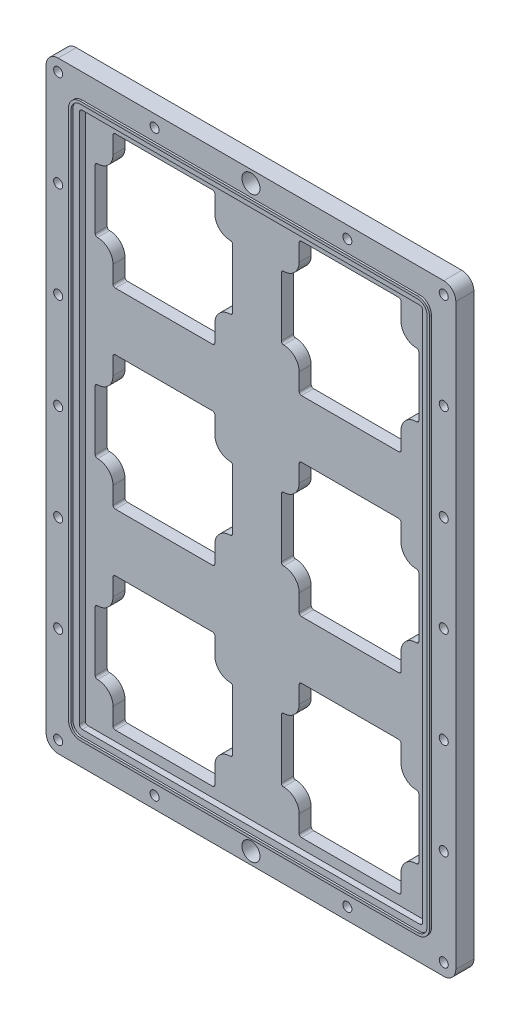
from build123d import *

# Parameters (mm, degrees)
SKETCH1_W            = 215.9
SKETCH1_H            = 317.5
BOSS_EXTRUDE1_DEPTH  = 9.525
SKETCH4_R            = 2.38125
CUT_EXTRUDE1_DEPTH   = 385.070026981
CUT_EXTRUDE3_DEPTH   = 3.175
BOSS_EXTRUDE2_DEPTH  = 1.016
SKETCH7_R            = 4.7625
CUT_EXTRUDE4_DEPTH   = 385.070026981
FILLET1_R            = 6.35
CUT_EXTRUDE5_DEPTH   = 3.175
CUT_EXTRUDE6_DEPTH   = 385.09656687
SKETCH11_R           = 1.3462
CUT_EXTRUDE7_DEPTH   = 4.7625
LPATTERN1_COUNT      = 2
LPATTERN1_PITCH      = 98.0948
LPATTERN1_COUNT_DIR2 = 3
LPATTERN1_PITCH_DIR2 = 100.8634


with BuildPart() as part:
    # Sketch1 → Boss-Extrude1 (new body)
    with BuildSketch(Plane.XY):
        with Locations((107.95, 158.75)):
            Rectangle(SKETCH1_W, SKETCH1_H)
    extrude(amount=BOSS_EXTRUDE1_DEPTH)

    # Sketch4 → Cut-Extrude1 (cut, through all)
    with BuildSketch(Plane.XY.offset(9.525)):
        with Locations((6.35, 6.35)):
            Circle(SKETCH4_R)
        with Locations((6.35, 311.15)):
            Circle(SKETCH4_R)
        with Locations((209.55, 311.15)):
            Circle(SKETCH4_R)
        with Locations((209.55, 6.35)):
            Circle(SKETCH4_R)
        with Locations((57.15, 311.15)):
            Circle(SKETCH4_R)
        with Locations((57.15, 6.35)):
            Circle(SKETCH4_R)
        with Locations((107.95, 311.15)):
            Circle(SKETCH4_R)
        with Locations((107.95, 6.35)):
            Circle(SKETCH4_R)
        with Locations((158.75, 311.15)):
            Circle(SKETCH4_R)
        with Locations((158.75, 6.35)):
            Circle(SKETCH4_R)
        with Locations((6.35, 260.35)):
            Circle(SKETCH4_R)
        with Locations((209.55, 260.35)):
            Circle(SKETCH4_R)
        with Locations((6.35, 209.55)):
            Circle(SKETCH4_R)
        with Locations((209.55, 209.55)):
            Circle(SKETCH4_R)
        with Locations((6.35, 158.75)):
            Circle(SKETCH4_R)
        with Locations((209.55, 158.75)):
            Circle(SKETCH4_R)
        with Locations((6.35, 107.95)):
            Circle(SKETCH4_R)
        with Locations((209.55, 107.95)):
            Circle(SKETCH4_R)
        with Locations((6.35, 57.15)):
            Circle(SKETCH4_R)
        with Locations((209.55, 57.15)):
            Circle(SKETCH4_R)
    extrude(amount=-CUT_EXTRUDE1_DEPTH, mode=Mode.SUBTRACT)

    # Sketch6 → Cut-Extrude3 (cut)
    with BuildSketch(Plane.XY.offset(9.525)):
        with BuildLine():
            Line((196.85, 300.0375), (19.05, 300.0375))
            ThreePointArc((19.05, 300.0375), (17.927467985, 299.572532015), (17.4625, 298.45))
            Line((17.4625, 298.45), (17.4625, 19.05))
            ThreePointArc((17.4625, 19.05), (17.927467985, 17.927467985), (19.05, 17.4625))
            Line((19.05, 17.4625), (196.85, 17.4625))
            ThreePointArc((196.85, 17.4625), (197.972532015, 17.927467985), (198.4375, 19.05))
            Line((198.4375, 19.05), (198.4375, 298.45))
            ThreePointArc((198.4375, 298.45), (197.972532015, 299.572532015), (196.85, 300.0375))
        make_face()
    extrude(amount=-CUT_EXTRUDE3_DEPTH, mode=Mode.SUBTRACT)

    # Sketch5 → Boss-Extrude2 (add)
    with BuildSketch(Plane.XY.offset(9.525)):
        with BuildLine():
            ThreePointArc((19.05, 304.673), (14.649674501, 302.850325499), (12.827, 298.45))
            Line((12.827, 298.45), (12.827, 19.05))
            ThreePointArc((12.827, 19.05), (14.649674501, 14.649674501), (19.05, 12.827))
            Line((19.05, 12.827), (196.85, 12.827))
            ThreePointArc((196.85, 12.827), (201.250325499, 14.649674501), (203.073, 19.05))
            Line((203.073, 19.05), (203.073, 298.45))
            ThreePointArc((203.073, 298.45), (201.250325499, 302.850325499), (196.85, 304.673))
            Line((196.85, 304.673), (19.05, 304.673))
        make_face()
        with BuildLine():
            ThreePointArc((196.85, 303.3395), (200.307398607, 301.907398607), (201.7395, 298.45))
            Line((201.7395, 298.45), (201.7395, 19.05))
            ThreePointArc((201.7395, 19.05), (200.307398607, 15.592601393), (196.85, 14.1605))
            Line((196.85, 14.1605), (19.05, 14.1605))
            ThreePointArc((19.05, 14.1605), (15.592601393, 15.592601393), (14.1605, 19.05))
            Line((14.1605, 19.05), (14.1605, 298.45))
            ThreePointArc((14.1605, 298.45), (15.592601393, 301.907398607), (19.05, 303.3395))
            Line((19.05, 303.3395), (196.85, 303.3395))
        make_face(mode=Mode.SUBTRACT)
    extrude(amount=BOSS_EXTRUDE2_DEPTH)

    # Sketch7 → Cut-Extrude4 (cut, through all)
    with BuildSketch(Plane.XY.offset(9.525)):
        with Locations((107.95, 6.35)):
            Circle(SKETCH7_R)
        with Locations((107.95, 311.15)):
            Circle(SKETCH7_R)
    extrude(amount=-CUT_EXTRUDE4_DEPTH, mode=Mode.SUBTRACT)

    # Fillet1
    fillet1_edges = [part.edges().sort_by_distance(p)[0] for p in [
        (0, 317.5, 4.7625),
        (215.9, 317.5, 4.7625),
        (0, 0, 4.7625),
        (215.9, 0, 4.7625),
    ]]
    fillet(fillet1_edges, radius=FILLET1_R)

    # Sketch8 → Cut-Extrude5 (cut)
    with BuildSketch(Plane(origin=(0, 0, 0), x_dir=(-1, 0, 0), z_dir=(0, 0, -1))):
        with BuildLine():
            Line((-131.3942, 298.45), (-182.6006, 298.45))
            ThreePointArc((-182.6006, 298.45), (-186.031057838, 297.029057838), (-187.452, 293.5986))
            Line((-187.452, 293.5986), (-187.452, 284.607))
            ThreePointArc((-187.452, 284.607), (-188.783668309, 281.392068309), (-191.9986, 280.0604))
            ThreePointArc((-191.9986, 280.0604), (-195.429057838, 278.639457838), (-196.85, 275.209))
            Line((-196.85, 275.209), (-196.85, 244.0178))
            ThreePointArc((-196.85, 244.0178), (-195.429057838, 240.587342162), (-191.9986, 239.1664))
            ThreePointArc((-191.9986, 239.1664), (-188.783668309, 237.834731691), (-187.452, 234.6198))
            Line((-187.452, 234.6198), (-187.452, 225.6282))
            ThreePointArc((-187.452, 225.6282), (-186.031057838, 222.197742162), (-182.6006, 220.7768))
            Line((-182.6006, 220.7768), (-131.3942, 220.7768))
            ThreePointArc((-131.3942, 220.7768), (-127.963742162, 222.197742162), (-126.5428, 225.6282))
            Line((-126.5428, 225.6282), (-126.5428, 234.6198))
            ThreePointArc((-126.5428, 234.6198), (-125.211131691, 237.834731691), (-121.9962, 239.1664))
            ThreePointArc((-121.9962, 239.1664), (-118.565742162, 240.587342162), (-117.1448, 244.0178))
            Line((-117.1448, 244.0178), (-117.1448, 275.209))
            ThreePointArc((-117.1448, 275.209), (-118.565742162, 278.639457838), (-121.9962, 280.0604))
            ThreePointArc((-121.9962, 280.0604), (-125.211131691, 281.392068309), (-126.5428, 284.607))
            Line((-126.5428, 284.607), (-126.5428, 293.5986))
            ThreePointArc((-126.5428, 293.5986), (-127.963742162, 297.029057838), (-131.3942, 298.45))
        make_face()
        with BuildLine():
            Line((-194.818, 275.209), (-194.818, 244.0178))
            ThreePointArc((-194.818, 244.0178), (-193.992216859, 242.024183141), (-191.9986, 241.1984))
            ThreePointArc((-191.9986, 241.1984), (-187.346827329, 239.271572671), (-185.42, 234.6198))
            Line((-185.42, 234.6198), (-185.42, 225.6282))
            ThreePointArc((-185.42, 225.6282), (-184.594216859, 223.634583141), (-182.6006, 222.8088))
            Line((-182.6006, 222.8088), (-131.3942, 222.8088))
            ThreePointArc((-131.3942, 222.8088), (-129.400583141, 223.634583141), (-128.5748, 225.6282))
            Line((-128.5748, 225.6282), (-128.5748, 234.6198))
            ThreePointArc((-128.5748, 234.6198), (-126.647972671, 239.271572671), (-121.9962, 241.1984))
            ThreePointArc((-121.9962, 241.1984), (-120.002583141, 242.024183141), (-119.1768, 244.0178))
            Line((-119.1768, 244.0178), (-119.1768, 275.209))
            ThreePointArc((-119.1768, 275.209), (-120.002583141, 277.202616859), (-121.9962, 278.0284))
            ThreePointArc((-121.9962, 278.0284), (-126.647972671, 279.955227329), (-128.5748, 284.607))
            Line((-128.5748, 284.607), (-128.5748, 293.5986))
            ThreePointArc((-128.5748, 293.5986), (-129.400583141, 295.592216859), (-131.3942, 296.418))
            Line((-131.3942, 296.418), (-182.6006, 296.418))
            ThreePointArc((-182.6006, 296.418), (-184.594216859, 295.592216859), (-185.42, 293.5986))
            Line((-185.42, 293.5986), (-185.42, 284.607))
            ThreePointArc((-185.42, 284.607), (-187.346827329, 279.955227329), (-191.9986, 278.0284))
            ThreePointArc((-191.9986, 278.0284), (-193.992216859, 277.202616859), (-194.818, 275.209))
        make_face(mode=Mode.SUBTRACT)
    cut_extrude5 = extrude(amount=-CUT_EXTRUDE5_DEPTH, mode=Mode.SUBTRACT)

    # Sketch10 → Cut-Extrude6 (cut, through all)
    with BuildSketch(Plane(origin=(0, 0, 0), x_dir=(-1, 0, 0), z_dir=(0, 0, -1))):
        with BuildLine():
            Line((-193.2305, 275.209), (-193.2305, 244.0178))
            ThreePointArc((-193.2305, 244.0178), (-192.869684844, 243.146715156), (-191.9986, 242.7859))
            ThreePointArc((-191.9986, 242.7859), (-186.224295314, 240.394104686), (-183.8325, 234.6198))
            Line((-183.8325, 234.6198), (-183.8325, 225.6282))
            ThreePointArc((-183.8325, 225.6282), (-183.471684844, 224.757115156), (-182.6006, 224.3963))
            Line((-182.6006, 224.3963), (-131.3942, 224.3963))
            ThreePointArc((-131.3942, 224.3963), (-130.523115156, 224.757115156), (-130.1623, 225.6282))
            Line((-130.1623, 225.6282), (-130.1623, 234.6198))
            ThreePointArc((-130.1623, 234.6198), (-127.770504686, 240.394104686), (-121.9962, 242.7859))
            ThreePointArc((-121.9962, 242.7859), (-121.125115156, 243.146715156), (-120.7643, 244.0178))
            Line((-120.7643, 244.0178), (-120.7643, 275.209))
            ThreePointArc((-120.7643, 275.209), (-121.125115156, 276.080084844), (-121.9962, 276.4409))
            ThreePointArc((-121.9962, 276.4409), (-127.770504686, 278.832695314), (-130.1623, 284.607))
            Line((-130.1623, 284.607), (-130.1623, 293.5986))
            ThreePointArc((-130.1623, 293.5986), (-130.523115156, 294.469684844), (-131.3942, 294.8305))
            Line((-131.3942, 294.8305), (-182.6006, 294.8305))
            ThreePointArc((-182.6006, 294.8305), (-183.471684844, 294.469684844), (-183.8325, 293.5986))
            Line((-183.8325, 293.5986), (-183.8325, 284.607))
            ThreePointArc((-183.8325, 284.607), (-186.224295314, 278.832695314), (-191.9986, 276.4409))
            ThreePointArc((-191.9986, 276.4409), (-192.869684844, 276.080084844), (-193.2305, 275.209))
        make_face()
    cut_extrude6 = extrude(amount=-CUT_EXTRUDE6_DEPTH, mode=Mode.SUBTRACT)

    # Sketch11 → Cut-Extrude7 (cut)
    with BuildSketch(Plane(origin=(0, 0, 0), x_dir=(-1, 0, 0), z_dir=(0, 0, -1))):
        with Locations((-191.9986, 293.6494)):
            Circle(SKETCH11_R)
        with Locations((-121.9962, 293.6494)):
            Circle(SKETCH11_R)
        with Locations((-121.9962, 225.5774)):
            Circle(SKETCH11_R)
        with Locations((-191.9986, 225.5774)):
            Circle(SKETCH11_R)
    cut_extrude7 = extrude(amount=-CUT_EXTRUDE7_DEPTH, mode=Mode.SUBTRACT)

    # LPattern1: Cut-Extrude5, Cut-Extrude6, Cut-Extrude7 2 × 3
    with Locations(*[(-i * LPATTERN1_PITCH, -j * LPATTERN1_PITCH_DIR2, 0) for i in range(LPATTERN1_COUNT) for j in range(LPATTERN1_COUNT_DIR2) if (i, j) != (0, 0)]):
        add(cut_extrude5, mode=Mode.SUBTRACT)
        add(cut_extrude6, mode=Mode.SUBTRACT)
        add(cut_extrude7, mode=Mode.SUBTRACT)


solid = part.part
